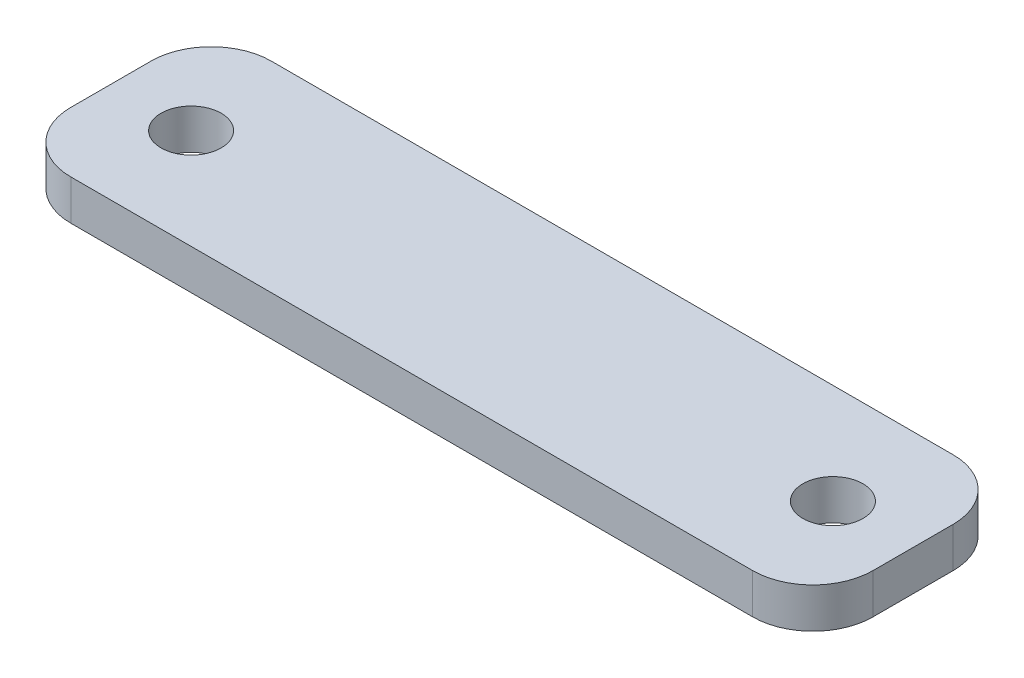
from build123d import *

# Parameters (mm, degrees)
SKETCH1_W             = 40
SKETCH1_H             = 10
BOSS_EXTRUDE1_DEPTH   = 2
FILLET1_R             = 3
F_3_0MM_DOWEL_HOLE1_D = 3


with BuildPart() as part:
    # Sketch1 → Boss-Extrude1 (new body)
    with BuildSketch(Plane(origin=(0, 0, 0), x_dir=(1, 0, 0), z_dir=(0, 1, 0))):
        Rectangle(SKETCH1_W, SKETCH1_H)
    extrude(amount=BOSS_EXTRUDE1_DEPTH)

    # Fillet1
    fillet1_edges = [part.edges().sort_by_distance(p)[0] for p in [
        (20, 1, 5),
        (20, 1, -5),
        (-20, 1, 5),
        (-20, 1, -5),
    ]]
    fillet(fillet1_edges, radius=FILLET1_R)

    # Ø3.0mm Dowel Hole1 (through all)
    with Locations(Plane(origin=(0, 0, 0), x_dir=(-1, 0, 0), z_dir=(0, -1, 0))):
        with Locations((-16, 0), (16, 0)):
            Hole(F_3_0MM_DOWEL_HOLE1_D / 2)


solid = part.part
